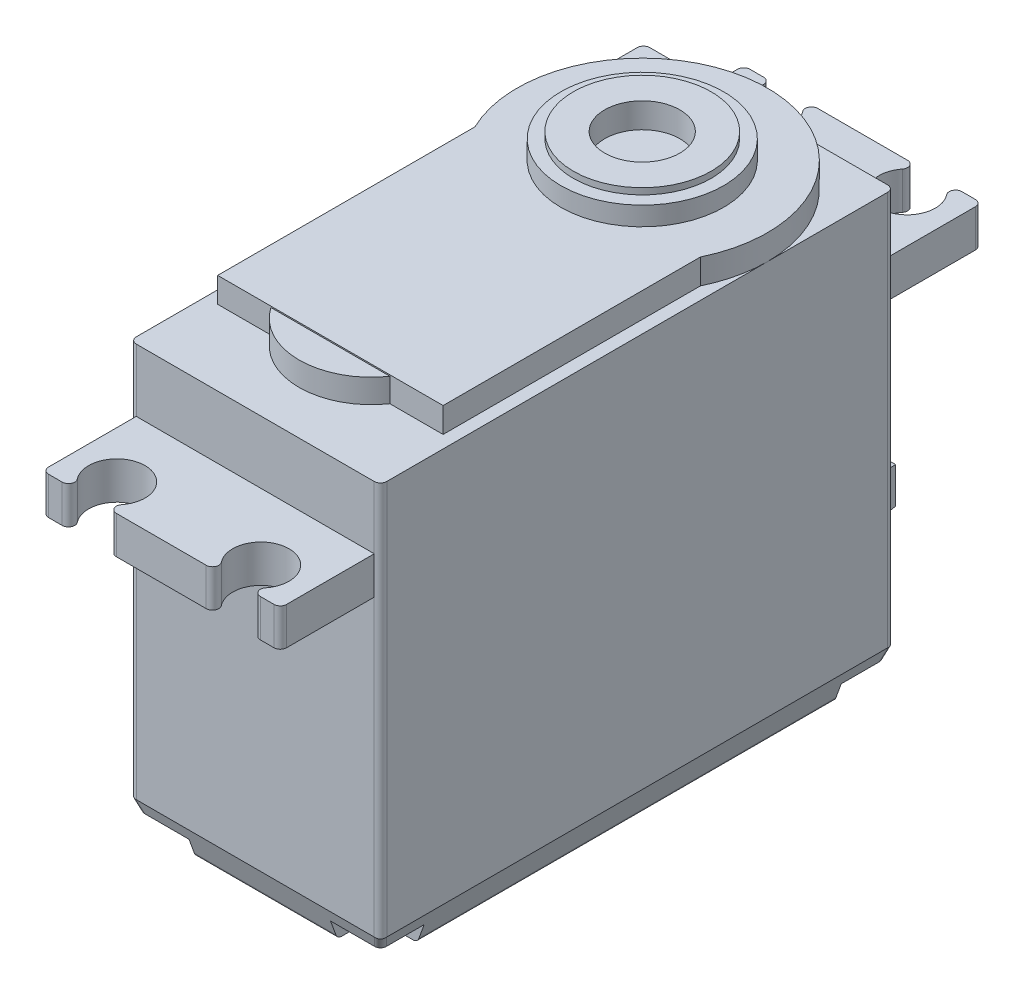
from build123d import *
from build123d.topology import SkipClean

# Parameters (mm, degrees)
SKETCH1_W                 = 41
SKETCH1_H                 = 34
BOSS_EXTRUDE1_DEPTH       = 20
BOSS_EXTRUDE2_DEPTH       = 2
BOSS_EXTRUDE3_DEPTH       = 1.9
SKETCH3_R                 = 6.5
SKETCH3_R_2               = 5.5
BOSS_EXTRUDE4_DEPTH       = 1.5
SKETCH3_3_R               = 5.5
SKETCH3_3_R_2             = 3
BOSS_EXTRUDE5_DEPTH       = 2
SKETCH10_R                = 0.825
CUT_EXTRUDE3_DEPTH        = 1.5
SKETCH10_10_R             = 0.825
CUT_EXTRUDE4_DEPTH        = 32
CHAMFER2_SIZE             = 2.5
CHAMFER2_SIZE2            = 0.909925586
CHAMFER2_PART_2_SIZE      = 2.5
CHAMFER2_PART_2_SIZE2     = 0.909925586
CHAMFER2_PART_3_SIZE      = 2.5
CHAMFER2_PART_3_SIZE2     = 0.909925586
CHAMFER2_PART_4_SIZE      = 2.5
CHAMFER2_PART_4_SIZE2     = 0.909925586
FILLET2_R                 = 0.5
SKETCH11_W                = 7.5
SKETCH11_H                = 4.1
BOSS_EXTRUDE10_DEPTH      = 7
BOSS_EXTRUDE10_TAPER      = 5
BOSS_EXTRUDE11_DEPTH      = 7.5
BOSS_EXTRUDE11_DEPTH_BACK = 48.5
SKETCH13_W                = 19
SKETCH13_H                = 3
SKETCH14_R                = 2.25
CUT_EXTRUDE5_DEPTH        = 8
FILLET3_R                 = 0.5
FILLET4_R                 = 0.5


with BuildPart() as part:
    # Sketch1 → Boss-Extrude1 (new body)
    with BuildSketch(Plane(origin=(0, 0, 0), x_dir=(0, 0, -1), z_dir=(1, 0, 0))):
        Rectangle(SKETCH1_W, SKETCH1_H)
    extrude(amount=BOSS_EXTRUDE1_DEPTH)

    # Sketch2 → Boss-Extrude2 (add)
    with BuildSketch(Plane(origin=(0, 17, 0), x_dir=(1, 0, 0), z_dir=(0, 1, 0))):
        with BuildLine():
            ThreePointArc((20, 10.4), (7.763932023, 20.146794345), (1, 6.041101056))
            Line((1, 6.041101056), (1, 10.5))
            Line((1, 10.5), (19, 10.5))
            Line((19, 10.5), (19, 6.041101056))
            ThreePointArc((19, 6.041101056), (19.746794345, 8.163932022), (20, 10.4))
        make_face()
        with BuildLine():
            Line((1, 10.5), (1, 6.041101056))
            ThreePointArc((1, 6.041101056), (10, 0.4), (19, 6.041101056))
            Line((19, 6.041101056), (19, 10.5))
            Line((19, 10.5), (1, 10.5))
        make_face()
        with BuildLine():
            Line((1, 6.041101056), (1, -14.5))
            Line((1, -14.5), (5.25, -14.5))
            Line((5.25, -14.5), (14.75, -14.5))
            Line((14.75, -14.5), (19, -14.5))
            Line((19, -14.5), (19, 6.041101056))
            ThreePointArc((19, 6.041101056), (10, 0.4), (1, 6.041101056))
        make_face()
    extrude(amount=BOSS_EXTRUDE2_DEPTH)

    # Sketch2<3> → Boss-Extrude3 (add)
    with BuildSketch(Plane(origin=(0, 17, 0), x_dir=(1, 0, 0), z_dir=(0, 1, 0))):
        with BuildLine():
            Line((14.75, -14.5), (5.25, -14.5))
            ThreePointArc((5.25, -14.5), (10, -17), (14.75, -14.5))
        make_face()
    extrude(amount=BOSS_EXTRUDE3_DEPTH)

    # Sketch3 → Boss-Extrude4 (add)
    with BuildSketch(Plane(origin=(0, 19, 0), x_dir=(1, 0, 0), z_dir=(0, 1, 0))):
        with Locations(Location((10, 10.4, 0), (0, 0, 270))):
            Circle(SKETCH3_R)
        with Locations(Location((10, 10.4, 0), (0, 0, 270))):
            Circle(SKETCH3_R_2, mode=Mode.SUBTRACT)
    extrude(amount=BOSS_EXTRUDE4_DEPTH)

    # Sketch3<3> → Boss-Extrude5 (add)
    with BuildSketch(Plane(origin=(0, 19, 0), x_dir=(1, 0, 0), z_dir=(0, 1, 0))):
        with Locations(Location((10, 10.4, 0), (0, 0, 270))):
            Circle(SKETCH3_3_R)
        with Locations(Location((10, 10.4, 0), (0, 0, 270))):
            Circle(SKETCH3_3_R_2, mode=Mode.SUBTRACT)
    extrude(amount=BOSS_EXTRUDE5_DEPTH)

    # Sketch10 → Cut-Extrude3 (cut)
    # profile 1 of 4: a face of its own
    with BuildSketch(Plane.XZ.offset(17)):
        with BuildLine():
            Line((0, 16.65), (2.5, 16.65))
            ThreePointArc((2.5, 16.65), (3.808147545, 17.191852455), (4.35, 18.5))
            Line((4.35, 18.5), (4.35, 20.5))
            Line((4.35, 20.5), (0, 20.5))
            Line((0, 20.5), (0, 16.65))
        make_face()
        with Locations(Location((2.5, 18.5, 0), (0, 0, 270))):
            Circle(SKETCH10_R, mode=Mode.SUBTRACT)
    # profile 2 of 4: a face of its own
    with BuildSketch(Plane.XZ.offset(17)):
        with BuildLine():
            Line((15.65, 18.5), (15.65, 20.5))
            Line((15.65, 20.5), (20, 20.5))
            Line((20, 20.5), (20, 16.65))
            Line((20, 16.65), (17.5, 16.65))
            ThreePointArc((17.5, 16.65), (16.191852455, 17.191852455), (15.65, 18.5))
        make_face()
        with Locations(Location((17.5, 18.5, 0), (0, 0, 90))):
            Circle(SKETCH10_R, mode=Mode.SUBTRACT)
    # profile 3 of 4: a face of its own
    with BuildSketch(Plane.XZ.offset(17)):
        with BuildLine():
            Line((4.35, -18.5), (4.35, -20.5))
            Line((4.35, -20.5), (0, -20.5))
            Line((0, -20.5), (0, -16.65))
            Line((0, -16.65), (2.5, -16.65))
            ThreePointArc((2.5, -16.65), (3.808147545, -17.191852455), (4.35, -18.5))
        make_face()
        with Locations(Location((2.5, -18.5, 0), (0, 0, 90))):
            Circle(SKETCH10_R, mode=Mode.SUBTRACT)
    # profile 4 of 4: a face of its own
    with BuildSketch(Plane.XZ.offset(17)):
        with BuildLine():
            Line((20, -16.65), (17.5, -16.65))
            ThreePointArc((17.5, -16.65), (16.191852455, -17.191852455), (15.65, -18.5))
            Line((15.65, -18.5), (15.65, -20.5))
            Line((15.65, -20.5), (20, -20.5))
            Line((20, -20.5), (20, -16.65))
        make_face()
        with Locations(Location((17.5, -18.5, 0), (0, 0, 270))):
            Circle(SKETCH10_R, mode=Mode.SUBTRACT)
    extrude(amount=-CUT_EXTRUDE3_DEPTH, mode=Mode.SUBTRACT)

    # Sketch10<10> → Cut-Extrude4 (cut)
    with BuildSketch(Plane.XZ.offset(17)):
        with Locations(Location((2.5, 18.5, 0), (0, 0, 270))):
            Circle(SKETCH10_10_R)
        with Locations(Location((17.5, 18.5, 0), (0, 0, 270))):
            Circle(SKETCH10_10_R)
        with Locations(Location((17.5, -18.5, 0), (0, 0, 270))):
            Circle(SKETCH10_10_R)
        with Locations(Location((2.5, -18.5, 0), (0, 0, 270))):
            Circle(SKETCH10_10_R)
    extrude(amount=-CUT_EXTRUDE4_DEPTH, mode=Mode.SUBTRACT)

    # Chamfer2
    chamfer2_edges = [part.edges().sort_by_distance(p)[0] for p in [
        (10, -17, 20.5),
    ]]
    chamfer2_side = [part.faces().sort_by_distance(p)[0] for p in [
        (10, 0.317958618, 20.5),
    ]]
    chamfer(chamfer2_edges, length=CHAMFER2_SIZE, length2=CHAMFER2_SIZE2, reference=chamfer2_side[0])

    # Chamfer2 part 2
    chamfer2_part_2_edges = [part.edges().sort_by_distance(p)[0] for p in [
        (20, -17, 0),
    ]]
    chamfer2_part_2_side = [part.faces().sort_by_distance(p)[0] for p in [
        (20, 0.135764404, 0),
    ]]
    chamfer(chamfer2_part_2_edges, length=CHAMFER2_PART_2_SIZE, length2=CHAMFER2_PART_2_SIZE2, reference=chamfer2_part_2_side[0])

    # Chamfer2 part 3
    chamfer2_part_3_edges = [part.edges().sort_by_distance(p)[0] for p in [
        (10, -17, -20.5),
    ]]
    chamfer2_part_3_side = [part.faces().sort_by_distance(p)[0] for p in [
        (10, 0.317958618, -20.5),
    ]]
    chamfer(chamfer2_part_3_edges, length=CHAMFER2_PART_3_SIZE, length2=CHAMFER2_PART_3_SIZE2, reference=chamfer2_part_3_side[0])

    # Chamfer2 part 4
    chamfer2_part_4_edges = [part.edges().sort_by_distance(p)[0] for p in [
        (0, -17, 0),
    ]]
    chamfer2_part_4_side = [part.faces().sort_by_distance(p)[0] for p in [
        (0, 0.135764404, 0),
    ]]
    chamfer(chamfer2_part_4_edges, length=CHAMFER2_PART_4_SIZE, length2=CHAMFER2_PART_4_SIZE2, reference=chamfer2_part_4_side[0])

    # Fillet2
    # the kernel refuses this fillet: 0.5 mm, written as the material it takes off along each edge
    with BuildSketch(Plane(origin=(20, 18.25, 20.5), x_dir=(-1, 0, 0), z_dir=(0, -1, 0)), Plane(origin=(0, -15.75, -20.5), x_dir=(0, 0, 1), z_dir=(0, 1, 0)), Plane(origin=(20, -15.75, -20.5), x_dir=(-1, 0, 0), z_dir=(0, 1, 0)), Plane(origin=(0, 18.25, 20.5), x_dir=(0, 0, -1), z_dir=(0, -1, 0))) as fillet2_piece_1:
        with BuildLine():
            CenterArc((FILLET2_R, FILLET2_R), FILLET2_R, 180, 90)
            Line((0, FILLET2_R), (0, 0))
            Line((0, 0), (FILLET2_R, 0))
        make_face()
    extrude(amount=34, mode=Mode.SUBTRACT)
    with BuildSketch(Plane(origin=(19.090074414, -17, 17.525259423), x_dir=(-1, 0, 0), z_dir=(0, 0, -1))) as fillet2_piece_2:
        with BuildLine():
            CenterArc((FILLET2_R * 0.70020753821, FILLET2_R), FILLET2_R, 200, 70)
            Line((-FILLET2_R * 0.239485082576, FILLET2_R * 0.657979856674), (0, 0))
            Line((0, 0), (FILLET2_R * 0.70020753821, 0))
        make_face()
    extrude(amount=35.050518846, mode=Mode.SUBTRACT)
    with BuildSketch(Plane(origin=(3.474740577, -17, 19.590074414), x_dir=(0, 0, -1), z_dir=(1, 0, 0))) as fillet2_piece_3:
        with BuildLine():
            CenterArc((FILLET2_R * 0.70020753821, FILLET2_R), FILLET2_R, 200, 70)
            Line((-FILLET2_R * 0.239485082576, FILLET2_R * 0.657979856674), (0, 0))
            Line((0, 0), (FILLET2_R * 0.70020753821, 0))
        make_face()
    extrude(amount=13.050518846, mode=Mode.SUBTRACT)
    with BuildSketch(Plane(origin=(0.909925586, -17, 17.525259423), x_dir=(1, 0, 0), z_dir=(0, 0, -1))) as fillet2_piece_4:
        with BuildLine():
            CenterArc((FILLET2_R * 0.70020753821, -FILLET2_R), FILLET2_R, 90, 70)
            Line((-FILLET2_R * 0.239485082576, -FILLET2_R * 0.657979856674), (0, 0))
            Line((0, 0), (FILLET2_R * 0.70020753821, 0))
        make_face()
    extrude(amount=35.050518846, mode=Mode.SUBTRACT)
    with BuildSketch(Plane(origin=(3.474740577, -17, -19.590074414), x_dir=(0, 0, 1), z_dir=(1, 0, 0))) as fillet2_piece_5:
        with BuildLine():
            CenterArc((FILLET2_R * 0.70020753821, -FILLET2_R), FILLET2_R, 90, 70)
            Line((-FILLET2_R * 0.239485082576, -FILLET2_R * 0.657979856674), (0, 0))
            Line((0, 0), (FILLET2_R * 0.70020753821, 0))
        make_face()
    extrude(amount=13.050518846, mode=Mode.SUBTRACT)
    with BuildSketch(Plane(origin=(20.359668978, -13.511817604, 20.859668978), x_dir=(-0.9461886483394651, 0.3040991697893314, 0.1106830460683821), z_dir=(-0.3236155771181854, -0.8891264907159879, -0.3236155771181854)), Plane(origin=(-0.359668978, -13.511817604, 20.859668978), x_dir=(-0.1106830460683816, 0.3040991697893315, -0.946188648339465), z_dir=(0.3236155771181852, -0.8891264907159879, -0.32361557711818534))) as fillet2_piece_6:
        with BuildLine():
            CenterArc((FILLET2_R * 0.889126490716, FILLET2_R), FILLET2_R, 186.717713464, 83.282286536)
            Line((-FILLET2_R * 0.104008041637, FILLET2_R * 0.883022221559), (0, 0))
            Line((0, 0), (FILLET2_R * 0.889126490716, 0))
        make_face()
    extrude(amount=3.347515592, mode=Mode.SUBTRACT)
    with BuildSketch(Plane(origin=(20.359668978, -13.511817604, -20.859668978), x_dir=(-0.9461886483394651, 0.3040991697893314, -0.1106830460683821), z_dir=(-0.3236155771181854, -0.8891264907159879, 0.3236155771181854)), Plane(origin=(-0.359668978, -13.511817604, -20.859668978), x_dir=(-0.11068304606838075, 0.3040991697893318, 0.9461886483394651), z_dir=(0.3236155771181852, -0.8891264907159879, 0.32361557711818534))) as fillet2_piece_7:
        with BuildLine():
            CenterArc((FILLET2_R * 0.889126490716, -FILLET2_R), FILLET2_R, 90, 83.282286536)
            Line((-FILLET2_R * 0.104008041637, -FILLET2_R * 0.883022221559), (0, 0))
            Line((0, 0), (FILLET2_R * 0.889126490716, 0))
        make_face()
    extrude(amount=3.347515592, mode=Mode.SUBTRACT)

    # Sketch11 → Boss-Extrude10 (add)
    with BuildSketch(Plane(origin=(0, 0, -20.5), x_dir=(-1, 0, 0), z_dir=(0, 0, -1))):
        with Locations((-10, -10.45)):
            Rectangle(SKETCH11_W, SKETCH11_H)
    extrude(amount=BOSS_EXTRUDE10_DEPTH, taper=BOSS_EXTRUDE10_TAPER)

    # Sketch13 → Boss-Extrude11 (add, two sides: drawn at the far end of the back side and taken through both)
    with BuildSketch(Plane.XY.offset(20.5).offset(-BOSS_EXTRUDE11_DEPTH_BACK)):
        with Locations((10, 10.5)):
            Rectangle(SKETCH13_W, SKETCH13_H)
    extrude(amount=BOSS_EXTRUDE11_DEPTH + BOSS_EXTRUDE11_DEPTH_BACK)

    # Sketch14 → Cut-Extrude5 (cut)
    with SkipClean():  # the faces are left unmerged after this step: merging them gives an invalid solid
        with BuildSketch(Plane(origin=(0, 12, 0), x_dir=(1, 0, 0), z_dir=(0, 1, 0))):
            with Locations((15.75, -25.8)):
                Circle(SKETCH14_R)
            with Locations((4.25, -25.8)):
                Circle(SKETCH14_R)
            with Locations((15.75, 25.8)):
                Circle(SKETCH14_R)
            with Locations((4.25, 25.8)):
                Circle(SKETCH14_R)
        extrude(amount=-CUT_EXTRUDE5_DEPTH, mode=Mode.SUBTRACT)

    # Fillet3
    fillet3_edges = [part.edges().sort_by_distance(p)[0] for p in [
        (15.278300943, 10.5, 28),
        (16.221699057, 10.5, 28),
        (3.778300943, 10.5, 28),
        (4.721699057, 10.5, 28),
        (16.221699057, 10.5, -28),
        (15.278300943, 10.5, -28),
        (4.721699057, 10.5, -28),
        (3.778300943, 10.5, -28),
    ]]
    fillet(fillet3_edges, radius=FILLET3_R)

    # Fillet4
    fillet4_edges = [part.edges().sort_by_distance(p)[0] for p in [
        (0.5, 10.5, -28),
        (19.5, 10.5, -28),
        (0.5, 10.5, 28),
        (19.5, 10.5, 28),
    ]]
    fillet(fillet4_edges, radius=FILLET4_R)


solid = part.part
